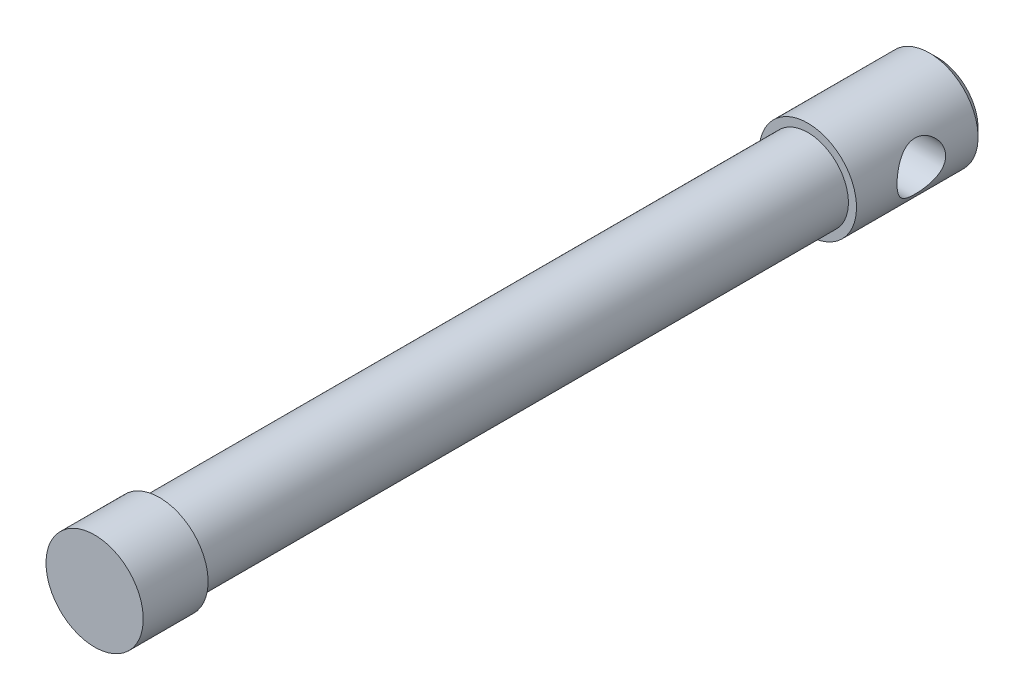
from build123d import *

# Parameters (mm, degrees)
F_3DSKETCH2_R           = 9.525
BOSS_EXTRUDE1_DEPTH     = 12.7
SKETCH1_R               = 7.9375
BOSS_EXTRUDE2_DEPTH     = 127
SKETCH2_R               = 9.525
BOSS_EXTRUDE3_DEPTH     = 25.4
CHAMFER2_SIZE           = 1.5875
CUT_EXTRUDE1_DEPTH      = 166.648607751
CUT_EXTRUDE1_DEPTH_BACK = 166.648607751
SKETCH3_R               = 4.7625


with BuildPart() as part:
    # 3DSketch2 → Boss-Extrude1 (new body)
    with BuildSketch(Plane(origin=(0, 0, 0), x_dir=(-1, 0, 0), z_dir=(0, 0, -1))):
        Circle(F_3DSKETCH2_R)
    extrude(amount=BOSS_EXTRUDE1_DEPTH)

    # Sketch1 → Boss-Extrude2 (add)
    with BuildSketch(Plane(origin=(0, 0, -12.7), x_dir=(-1, 0, 0), z_dir=(0, 0, -1))):
        Circle(SKETCH1_R)
    extrude(amount=BOSS_EXTRUDE2_DEPTH)

    # Sketch2 → Boss-Extrude3 (add)
    with BuildSketch(Plane(origin=(0, 0, -139.7), x_dir=(-1, 0, 0), z_dir=(0, 0, -1))):
        Circle(SKETCH2_R)
    extrude(amount=BOSS_EXTRUDE3_DEPTH)

    # Chamfer2
    chamfer2_edges = [part.edges().sort_by_distance(p)[0] for p in [
        (9.525, 0, -165.1),
    ]]
    chamfer(chamfer2_edges, length=CHAMFER2_SIZE)

    # Sketch3 → Cut-Extrude1 (cut, two sides: drawn at the far end of the back side and taken through both)
    with BuildSketch(Plane(origin=(0, 0, 0), x_dir=(0, 0, -1), z_dir=(1, 0, 0)).offset(-CUT_EXTRUDE1_DEPTH_BACK)):
        with Locations((152.4, 0)):
            Circle(SKETCH3_R)
    extrude(amount=CUT_EXTRUDE1_DEPTH + CUT_EXTRUDE1_DEPTH_BACK, mode=Mode.SUBTRACT)


solid = part.part
